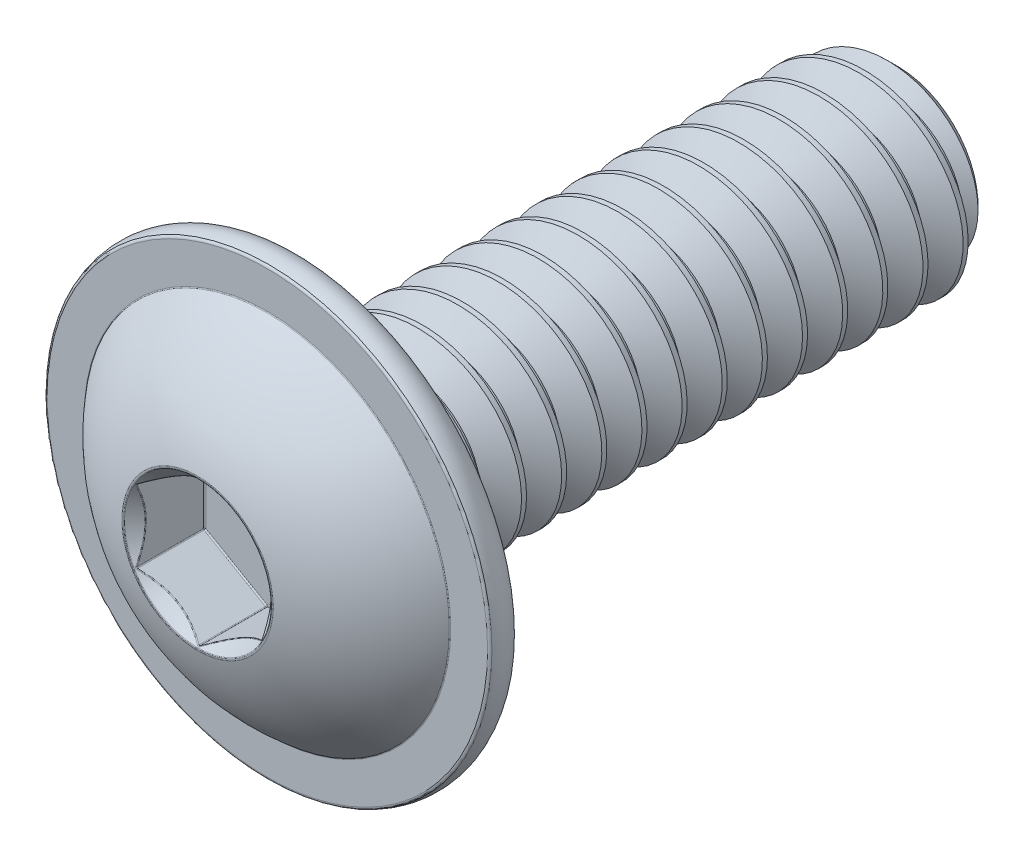
from build123d import *

# Parameters (mm, degrees)
CUT_EXTRUDE1_DEPTH = 2.2098
SKETCH5_R          = 2.331046381
CUT_EXTRUDE2_DEPTH = 2.2098
CUT_EXTRUDE2_DRAFT = -45
FILLET3_R          = 0.0396875
FILLET4_R          = 0.0889
CUT_SWEEP1_PITCH   = 1.27
CUT_SWEEP1_TO      = 18.542


with BuildPart() as part:
    # Sketch3 → Revolve1 (revolve)
    with BuildSketch(Plane(origin=(0, 0, 0), x_dir=(0, 0, -1), z_dir=(1, 0, 0)), mode=Mode.PRIVATE) as revolve1_sk:
        with BuildLine():
            Line((-11.0744, 0), (-11.0744, 2.390577631))
            ThreePointArc((-11.0744, 2.390577631), (-10.247645751, 4.26596165), (-8.8646, 5.7785))
            Line((-8.8646, 5.7785), (-8.8646, 7.0231))
            ThreePointArc((-8.8646, 7.0231), (-8.407178544, 7.10786456), (-7.9756, 6.9342))
            Line((-7.9756, 6.9342), (-7.9756, 3.683))
            ThreePointArc((-7.9756, 3.683), (-7.826810245, 3.323789755), (-7.4676, 3.175))
            Line((-7.4676, 3.175), (10.4394, 3.175))
            Line((10.4394, 3.175), (11.0744, 2.54))
            Line((11.0744, 2.54), (11.0744, 0))
            Line((11.0744, 0), (-11.0744, 0))
        make_face()
    revolve(revolve1_sk.sketch.rotate(Axis((0, 0, -11.0744), (0, 0, 1)), 90), axis=Axis((0, 0, -11.0744), (0, 0, 1)))

    # Sketch4 → Cut-Extrude1 (cut)
    with BuildSketch(Plane.XY.offset(11.0744)):
        Polygon((0, 2.291358881), (-1.984375, 1.14567944), (-1.984375, -1.14567944), (0, -2.291358881), (1.984375, -1.14567944), (1.984375, 1.14567944), align=None)
    extrude(amount=-CUT_EXTRUDE1_DEPTH, mode=Mode.SUBTRACT)


with BuildPart() as cut_extrude2_tool:
    # Sketch5 → Cut-Extrude2 (with draft: the straight prism first)
    with BuildSketch(Plane.XY.offset(11.0744)):
        Circle(SKETCH5_R)
    extrude(amount=-CUT_EXTRUDE2_DEPTH)
    # Cut-Extrude2: the draft: its side faces are tilted about the plane it starts from
    cut_extrude2_sides = [cut_extrude2_tool.faces().sort_by_distance(p)[0] for p in [
        (-2.331046381, 0, 9.9695),
    ]]
    draft(cut_extrude2_sides, Plane.XY.offset(11.0744), CUT_EXTRUDE2_DRAFT)


with BuildPart() as part_1:
    add(part.part)

    # Cut-Extrude2: cut by cut_extrude2_tool
    add(cut_extrude2_tool.part, mode=Mode.SUBTRACT)

    # Fillet3
    fillet3_edges = [part_1.edges().sort_by_distance(p)[0] for p in [
        (0, 2.291358881, 9.94965625),
        (1.984375, 1.14567944, 9.94965625),
        (1.984375, -1.14567944, 9.94965625),
        (0, -2.291358881, 9.94965625),
        (-1.984375, -1.14567944, 9.94965625),
        (-1.984375, 1.14567944, 9.94965625),
        (0.9921875, 1.718519161, 8.8646),
        (1.984375, 0, 8.8646),
        (0.9921875, -1.718519161, 8.8646),
        (-0.9921875, -1.718519161, 8.8646),
        (-1.984375, 0, 8.8646),
        (-0.9921875, 1.718519161, 8.8646),
        (-2.331046381, 0, 11.0744),
        (1.984375, -0.5903679, 10.813686539),
        (0.9921875, 1.718519161, 10.727728619),
        (-0.9921875, 1.718519161, 10.727728619),
        (-1.984375, 0, 10.727728619),
        (-0.9921875, -1.718519161, 10.727728619),
        (0.9921875, -1.718519161, 10.727728619),
        (2.390577631, 0, 11.0744),
        (5.7785, 0, 8.8646),
    ]]
    fillet(fillet3_edges, radius=FILLET3_R)

    # Fillet4
    fillet4_edges = [part_1.edges().sort_by_distance(p)[0] for p in [
        (7.0231, 0, 8.8646),
        (6.9342, 0, 7.9756),
    ]]
    fillet(fillet4_edges, radius=FILLET4_R)


with BuildPart() as body_2:
    # Split1: the piece on the far side of the plane
    add(part_1.part)
    split(bisect_by=Plane.XY.offset(7.4676), keep=Keep.BOTTOM)

    # Cut-Sweep1: arcs per turn and ends read off the stored shape
    # Cut-Sweep1: the profile of Sketch7 screwed along a right-hand helix through 16.5 turns, 8 arcs to a turn; built about Z, then put on its axis
    cut_sweep1_z = Axis((0, 0, 0), (0, 0, 1))
    cut_sweep1_corners = [(3.243740766, 0, 0.0396875), (3.243740766, 0, -1.1509375), (2.350110803, 0, -0.635), (2.350110803, 0, -0.47625)]
    with BuildLine(mode=Mode.PRIVATE) as cut_sweep1_profile:
        Line(cut_sweep1_corners[0], cut_sweep1_corners[1])
        Line(cut_sweep1_corners[1], cut_sweep1_corners[2])
        Line(cut_sweep1_corners[2], cut_sweep1_corners[3])
        Line(cut_sweep1_corners[3], cut_sweep1_corners[0])
    cut_sweep1_cap = Face(cut_sweep1_profile.wire())
    cut_sweep1_turn_angles = [0, 22.5, 45, 67.5, 90, 112.5, 135, 157.5, 180, 202.5, 225, 247.5, 270, 292.5, 315, 337.5, 360]
    cut_sweep1_turn_weights = [1, 0.9238795325112867, 1, 0.9238795325112867, 1, 0.9238795325112867, 1, 0.9238795325112867, 1, 0.9238795325112867, 1, 0.9238795325112867, 1, 0.9238795325112867, 1, 0.9238795325112867, 1]
    cut_sweep1_turn_rails = [Edge.make_bspline([Vector(p[0], p[1], 0).rotate(cut_sweep1_z, cut_sweep1_turn_angles[k]) / cut_sweep1_turn_weights[k] + Vector(0, 0, p[2] + CUT_SWEEP1_PITCH * cut_sweep1_turn_angles[k] / 360) for k in range(17)], [0, 0, 0, 1, 1, 2, 2, 3, 3, 4, 4, 5, 5, 6, 6, 7, 7, 8, 8, 8], 2, cut_sweep1_turn_weights) for p in cut_sweep1_corners]
    cut_sweep1_turn_sides = [Face.make_surface_from_curves(cut_sweep1_turn_rails[p[0]], cut_sweep1_turn_rails[p[1]]) for p in [(0, 1), (1, 2), (2, 3), (3, 0)]]
    cut_sweep1_last_angles = [5760, 5782.5, 5805, 5827.5, 5850, 5872.5, 5895, 5917.5, 5940]
    cut_sweep1_last_weights = [1, 0.9238795325112867, 1, 0.9238795325112867, 1, 0.9238795325112867, 1, 0.9238795325112685, 1]
    cut_sweep1_last_rails = [Edge.make_bspline([Vector(p[0], p[1], 0).rotate(cut_sweep1_z, cut_sweep1_last_angles[k]) / cut_sweep1_last_weights[k] + Vector(0, 0, p[2] + CUT_SWEEP1_PITCH * cut_sweep1_last_angles[k] / 360) for k in range(9)], [0, 0, 0, 1, 1, 2, 2, 3, 3, 4, 4, 4], 2, cut_sweep1_last_weights) for p in cut_sweep1_corners]
    cut_sweep1_last_sides = [Face.make_surface_from_curves(cut_sweep1_last_rails[p[0]], cut_sweep1_last_rails[p[1]]) for p in [(0, 1), (1, 2), (2, 3), (3, 0)]]
    cut_sweep1 = Plane(origin=(0, 0, -11.0744), x_dir=(0, 1, 0), z_dir=(0, 0, 1)) * split(Solid(Shell([*[p.moved(Location((0, 0, CUT_SWEEP1_PITCH * i))) for i in range(16) for p in cut_sweep1_turn_sides], *cut_sweep1_last_sides, cut_sweep1_cap, cut_sweep1_cap.rotate(cut_sweep1_z, 5940).moved(Location((0, 0, CUT_SWEEP1_PITCH * 5940 / 360)))])), bisect_by=Plane.XY.offset(CUT_SWEEP1_TO), keep=Keep.BOTTOM, mode=Mode.PRIVATE)
    add(cut_sweep1, mode=Mode.SUBTRACT)


with BuildPart() as part_2:
    add(part_1.part)

    # Split1
    split(bisect_by=Plane.XY.offset(7.4676), keep=Keep.TOP)

    add(body_2.part)  # Boss-Extrude1 merges body 2
    # Boss-Extrude1 cone 1 section (through the dimple's axis) → Boss-Extrude1 (revolve)
    with BuildSketch(Plane(origin=(0, 0, 7.4676), x_dir=(0, -1, 0), z_dir=(1, 0, 0))):
        Polygon((0, 0), (3.175, 0), (0, 3.175), align=None)
    revolve(axis=Axis((0, 0, 7.4676), (0, 0, -1)))


solid = part_2.part
